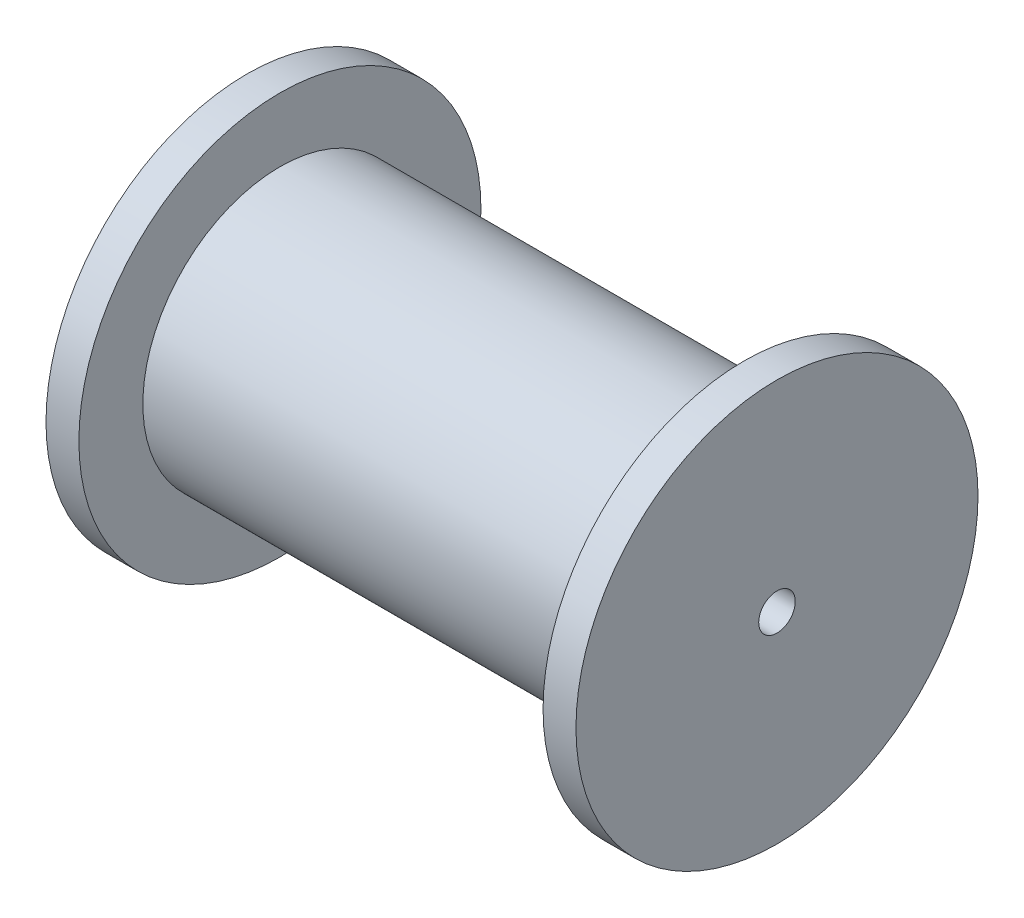
from build123d import *

# Parameters (mm, degrees)
SKETCH2_R          = 2
CUT_EXTRUDE1_DEPTH = 66.817930688


with BuildPart() as part:
    # Sketch1 → Revolve1 (revolve)
    with BuildSketch(Plane.XY):
        Polygon((0, 0), (0, 22), (-3.6, 22), (-3.6, 15), (-54.4, 15), (-54.4, 22), (-58, 22), (-58, 0), align=None)
    revolve(axis=Axis((0, 0, 0), (-1, 0, 0)))

    # Sketch2 → Cut-Extrude1 (cut, through all)
    with BuildSketch(Plane.ZY.offset(58)):
        Circle(SKETCH2_R)
    extrude(amount=-CUT_EXTRUDE1_DEPTH, mode=Mode.SUBTRACT)


solid = part.part
